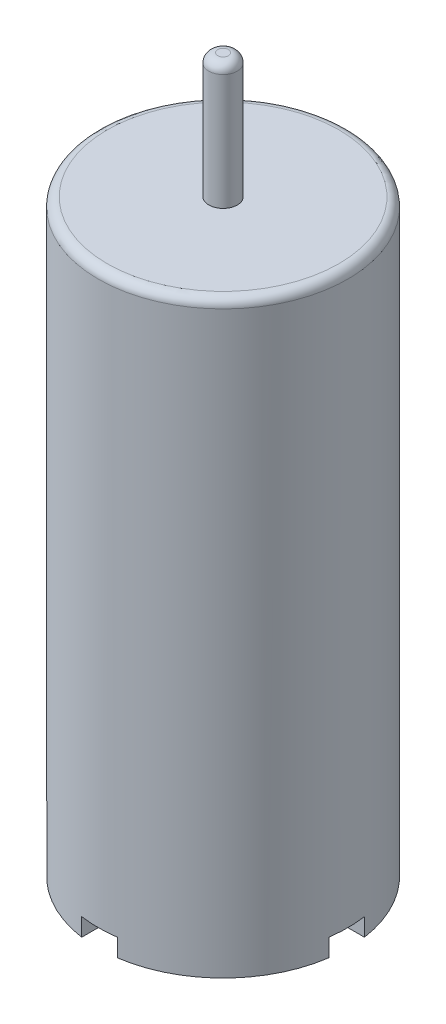
from build123d import *

# Parameters (mm, degrees)
SKETCH1_R           = 3.5
BOSS_EXTRUDE1_DEPTH = 16
BOSS_EXTRUDE2_START = 0.5
BOSS_EXTRUDE2_DEPTH = 0.5
SKETCH3_R           = 0.4
BOSS_EXTRUDE3_DEPTH = 3.5
FILLET2_R           = 0.25
FILLET3_R           = 0.25


with BuildPart() as part:
    # Sketch1 → Boss-Extrude1 (new body)
    with BuildSketch(Plane(origin=(0, 0, 0), x_dir=(1, 0, 0), z_dir=(0, 1, 0))):
        Circle(SKETCH1_R)
    extrude(amount=BOSS_EXTRUDE1_DEPTH)

    # Sketch2 → Boss-Extrude2 (add)
    with BuildSketch(Plane.XZ.offset(BOSS_EXTRUDE2_START)):
        with BuildLine():
            Line((-0.5, 2.964101615), (0.5, 2.964101615))
            Line((0.5, 2.964101615), (0.5, 3.464101615))
            ThreePointArc((0.5, 3.464101615), (2.474873734, 2.474873734), (3.464101615, 0.5))
            Line((3.464101615, 0.5), (2.964101615, 0.5))
            Line((2.964101615, 0.5), (2.964101615, -0.5))
            Line((2.964101615, -0.5), (3.464101615, -0.5))
            ThreePointArc((3.464101615, -0.5), (2.474873734, -2.474873734), (0.5, -3.464101615))
            Line((0.5, -3.464101615), (0.5, -2.964101615))
            Line((0.5, -2.964101615), (-0.5, -2.964101615))
            Line((-0.5, -2.964101615), (-0.5, -3.464101615))
            ThreePointArc((-0.5, -3.464101615), (-2.474873734, -2.474873734), (-3.464101615, -0.5))
            Line((-3.464101615, -0.5), (-2.964101615, -0.5))
            Line((-2.964101615, -0.5), (-2.964101615, 0.5))
            Line((-2.964101615, 0.5), (-3.464101615, 0.5))
            ThreePointArc((-3.464101615, 0.5), (-2.474873734, 2.474873734), (-0.5, 3.464101615))
            Line((-0.5, 3.464101615), (-0.5, 2.964101615))
        make_face()
    extrude(amount=-BOSS_EXTRUDE2_DEPTH)

    # Sketch3 → Boss-Extrude3 (add)
    with BuildSketch(Plane(origin=(0, 16, 0), x_dir=(1, 0, 0), z_dir=(0, 1, 0))):
        Circle(SKETCH3_R)
    extrude(amount=BOSS_EXTRUDE3_DEPTH)

    # Fillet2
    fillet2_edges = [part.edges().sort_by_distance(p)[0] for p in [
        (-3.5, 16, 0),
    ]]
    fillet(fillet2_edges, radius=FILLET2_R)

    # Fillet3
    fillet3_edges = [part.edges().sort_by_distance(p)[0] for p in [
        (-0.4, 19.5, 0),
    ]]
    fillet(fillet3_edges, radius=FILLET3_R)


solid = part.part
